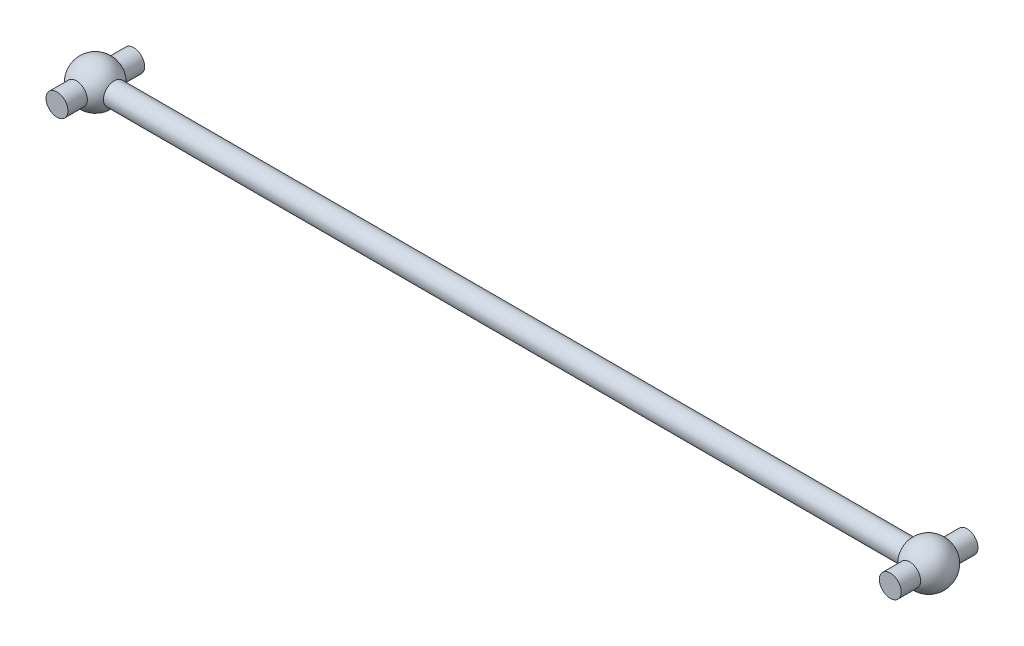
from build123d import *

# Parameters (mm, degrees)
SKETCH1_3_R         = 1.5875
BOSS_EXTRUDE1_DEPTH = 5.55625


with BuildPart() as part:
    # Sketch1 → Revolve1 (revolve)
    with BuildSketch(Plane.XY):
        with BuildLine():
            Line((117.900369343, 1.5875), (2.749630657, 1.5875))
            ThreePointArc((2.749630657, 1.5875), (-0.821750468, 3.066814498), (-3.175, 0))
            Line((-3.175, 0), (123.825, 0))
            ThreePointArc((123.825, 0), (121.471750468, 3.066814498), (117.900369343, 1.5875))
        make_face()
    revolve(axis=Axis((123.825, 0, 0), (-1, 0, 0)))

    # Sketch1<3> → Boss-Extrude1 (add, symmetric)
    with BuildSketch(Plane.XY):
        Circle(SKETCH1_3_R)
        with Locations((120.65, 0)):
            Circle(SKETCH1_3_R)
    extrude(amount=BOSS_EXTRUDE1_DEPTH, both=True)


solid = part.part
